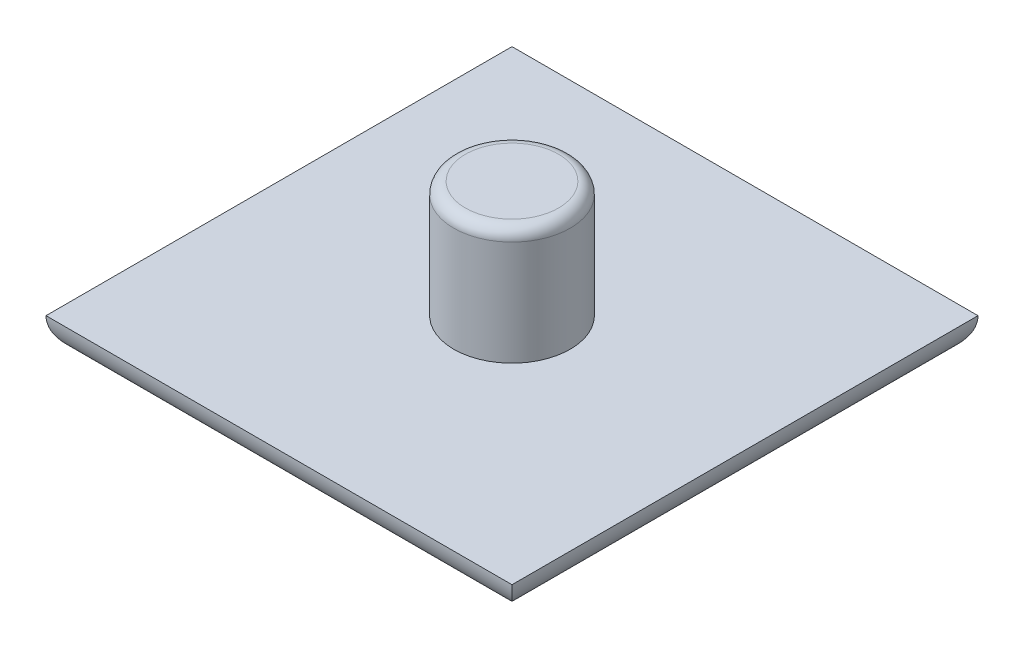
from build123d import *

# Parameters (mm, degrees)
SKETCH_1_W      = 20
SKETCH_1_H      = 20
EXTRUDE_1_DEPTH = 1.5
SKETCH_2_R      = 2.5
EXTRUDE_2_DEPTH = 5
FILLET_1_R      = 1.5
FILLET_2_R      = 0.5


with BuildPart() as part:
    # 草图1 → 凸台-拉伸1 (new body)
    with BuildSketch(Plane(origin=(0, 0, 0), x_dir=(1, 0, 0), z_dir=(0, 1, 0))):
        Rectangle(SKETCH_1_W, SKETCH_1_H)
    extrude(amount=EXTRUDE_1_DEPTH)

    # 草图2 → 凸台-拉伸2 (add)
    with BuildSketch(Plane(origin=(0, 1.5, 0), x_dir=(1, 0, 0), z_dir=(0, 1, 0))):
        with Locations(Location((0, 0, 0), (0, 0, 270))):
            Circle(SKETCH_2_R)
    extrude(amount=EXTRUDE_2_DEPTH)

    # 圆角1
    fillet_1_edges = [part.edges().sort_by_distance(p)[0] for p in [
        (0, 0, 10),
        (10, 0, 0),
        (0, 0, -10),
        (-10, 0, 0),
    ]]
    fillet(fillet_1_edges, radius=FILLET_1_R - 0.0001)  # a hair under: the kernel refuses the full size

    # 圆角2
    fillet_2_edges = [part.edges().sort_by_distance(p)[0] for p in [
        (0, 6.5, -2.5),
    ]]
    fillet(fillet_2_edges, radius=FILLET_2_R)


solid = part.part
